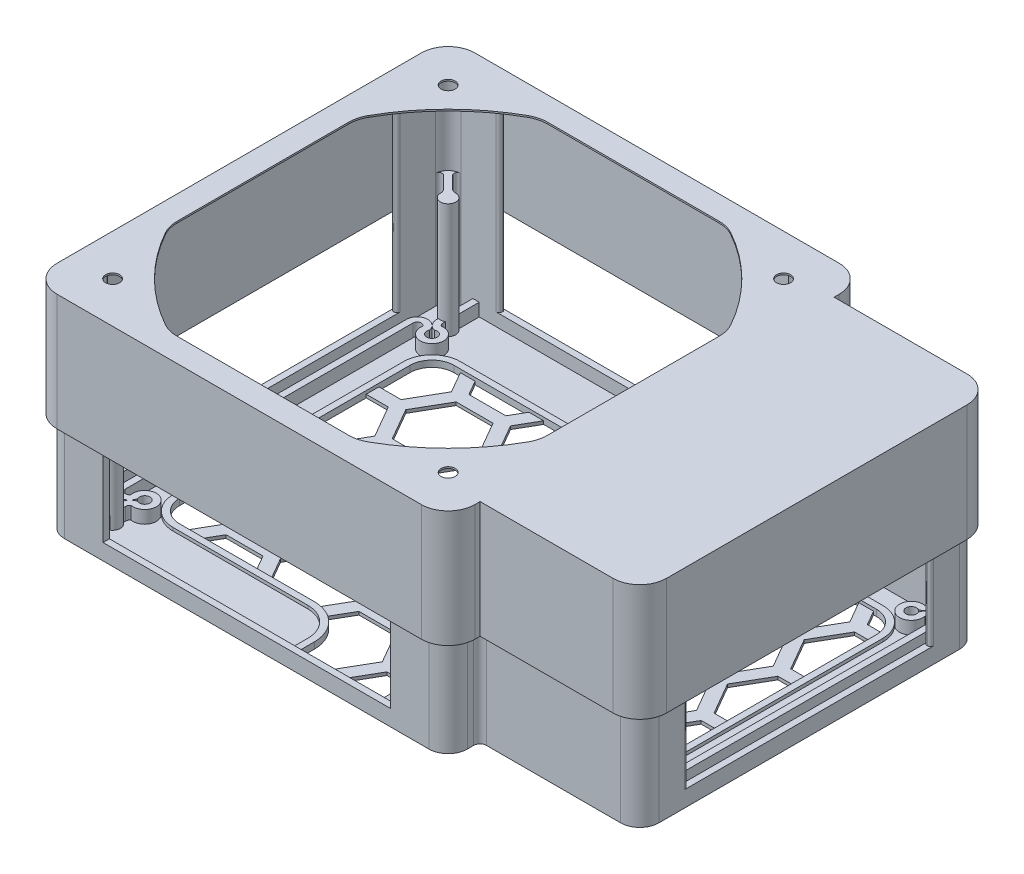
from build123d import *
from build123d.topology import SkipClean

# Parameters (mm, degrees)
BOSS_EXTRUDE1_DEPTH = 1
EXTRUDE_THIN1_START = 66
EXTRUDE_THIN1_DEPTH = 66
EXTRUDE_THIN3_DEPTH = 4
EXTRUDE_THIN4_DEPTH = 4
EXTRUDE_THIN5_DEPTH = 1
EXTRUDE_THIN6_DEPTH = 1
CUT_EXTRUDE1_START  = -1
CUT_EXTRUDE1_DEPTH  = 1
EXTRUDE_THIN7_DEPTH = 36
SKETCH9_R           = 2.2
BOSS_EXTRUDE2_DEPTH = 0.5
SKETCH10_W          = 7.592650154
SKETCH10_H          = 90
SKETCH10_W_2        = 89.999982454
SKETCH10_H_2        = 7.943548526
SKETCH10_W_3        = 13.63014597
SKETCH10_H_3        = 76
CUT_EXTRUDE2_DEPTH  = 62
FILLET1_R           = 1
BOSS_EXTRUDE3_DEPTH = 36
FILLET2_R           = 1


with BuildPart() as part:
    # Sketch1 → Boss-Extrude1 (new body)
    with BuildSketch(Plane(origin=(0, 0, 0), x_dir=(1, 0, 0), z_dir=(0, 1, 0))):
        with BuildLine():
            Line((40.005285897, 52.999974942), (81.994696809, 52.999974942))
            ThreePointArc((81.994696809, 52.999974942), (86.237336778, 51.242616347), (87.994696809, 46.999976973))
            Line((87.994696809, 46.999976973), (87.994728634, -46.999975311))
            ThreePointArc((87.994728634, -46.999975311), (86.237370039, -51.242617311), (81.994728634, -52.999977342))
            Line((81.994728634, -52.999977342), (40.005285897, -52.999977342))
            ThreePointArc((40.005285897, -52.999977342), (38.591072335, -53.58576378), (38.005285897, -54.999977342))
            Line((38.005285897, -54.999977342), (38.005285897, -57))
            ThreePointArc((38.005285897, -57), (36.247926584, -61.242640687), (32.005285897, -63))
            Line((32.005285897, -63), (-81.994731649, -63))
            ThreePointArc((-81.994731649, -63), (-86.237372989, -61.242640034), (-87.994731649, -56.999998153))
            Line((-87.994731649, -56.999998153), (-87.994696557, 57.000001847))
            ThreePointArc((-87.994696557, 57.000001847), (-86.237336591, 61.24264134), (-81.994696557, 63))
            Line((-81.994696557, 63), (32.005285897, 63))
            ThreePointArc((32.005285897, 63), (36.247926584, 61.242640687), (38.005285897, 57))
            Line((38.005285897, 57), (38.005285897, 54.999974942))
            ThreePointArc((38.005285897, 54.999974942), (38.591072335, 53.58576138), (40.005285897, 52.999974942))
        make_face()
    extrude(amount=-BOSS_EXTRUDE1_DEPTH)

    # Sketch2 → Extrude-Thin1 (add)
    with BuildSketch(Plane(origin=(0, 0, 0), x_dir=(1, 0, 0), z_dir=(0, 1, 0)).offset(EXTRUDE_THIN1_START)):
        with BuildLine():
            Line((38.005285897, 54.999974942), (38.005285897, 57))
            ThreePointArc((38.005285897, 57), (36.247926584, 61.242640687), (32.005285897, 63))
            Line((32.005285897, 63), (-81.994696557, 63))
            ThreePointArc((-81.994696557, 63), (-86.237336591, 61.24264134), (-87.994696557, 57.000001847))
            Line((-87.994696557, 57.000001847), (-87.994731649, -56.999998153))
            ThreePointArc((-87.994731649, -56.999998153), (-86.237372989, -61.242640034), (-81.994731649, -63))
            Line((-81.994731649, -63), (32.005285897, -63))
            ThreePointArc((32.005285897, -63), (36.247926584, -61.242640687), (38.005285897, -57))
            Line((38.005285897, -57), (38.005285897, -54.999977342))
            ThreePointArc((38.005285897, -54.999977342), (38.591072335, -53.58576378), (40.005285897, -52.999977342))
            Line((40.005285897, -52.999977342), (81.994728634, -52.999977342))
            ThreePointArc((81.994728634, -52.999977342), (86.237370039, -51.242617311), (87.994728634, -46.999975311))
            Line((87.994728634, -46.999975311), (87.994696809, 46.999976973))
            ThreePointArc((87.994696809, 46.999976973), (86.237336778, 51.242616347), (81.994696809, 52.999974942))
            Line((81.994696809, 52.999974942), (40.005285897, 52.999974942))
            ThreePointArc((40.005285897, 52.999974942), (38.591072335, 53.58576138), (38.005285897, 54.999974942))
        make_face()
        with BuildLine():
            Line((36.005285897, 54.999974942), (36.005285897, 57))
            ThreePointArc((36.005285897, 57), (34.833713022, 59.828427125), (32.005285897, 61))
            Line((32.005285897, 61), (-81.994696557, 61))
            ThreePointArc((-81.994696557, 61), (-84.823123246, 59.82842756), (-85.994696557, 57.000001231))
            Line((-85.994696557, 57.000001231), (-85.994731649, -56.999998769))
            ThreePointArc((-85.994731649, -56.999998769), (-84.823159209, -59.828426689), (-81.994731649, -61))
            Line((-81.994731649, -61), (32.005285897, -61))
            ThreePointArc((32.005285897, -61), (34.833713022, -59.828427125), (36.005285897, -57))
            Line((36.005285897, -57), (36.005285897, -54.999977342))
            ThreePointArc((36.005285897, -54.999977342), (37.176858772, -52.171550217), (40.005285897, -50.999977342))
            Line((40.005285897, -50.999977342), (81.994728634, -50.999977342))
            ThreePointArc((81.994728634, -50.999977342), (84.823156237, -49.828403988), (85.994728634, -46.999975988))
            Line((85.994728634, -46.999975988), (85.994696809, 46.999976296))
            ThreePointArc((85.994696809, 46.999976296), (84.823123455, 49.828402546), (81.994696809, 50.999974942))
            Line((81.994696809, 50.999974942), (40.005285897, 50.999974942))
            ThreePointArc((40.005285897, 50.999974942), (37.176858772, 52.171547817), (36.005285897, 54.999974942))
        make_face(mode=Mode.SUBTRACT)
    extrude(amount=-EXTRUDE_THIN1_DEPTH)

    # Sketch5 → Extrude-Thin3 (add)
    with BuildSketch(Plane(origin=(0, 0, 0), x_dir=(1, 0, 0), z_dir=(0, 1, 0))):
        with BuildLine():
            ThreePointArc((74.918497185, 50.999974942), (76.200703863, 50.05163324), (75.669349846, 48.547948147))
            ThreePointArc((75.669349846, 48.547948147), (72.440089862, 42.362287591), (78.586050254, 45.666479991))
            ThreePointArc((78.586050254, 45.666479991), (80.043916618, 46.249610745), (80.994697517, 45.000038221))
            Line((80.994697517, 45.000038221), (80.994727987, -45.00003632))
            ThreePointArc((80.994727987, -45.00003632), (80.043947973, -46.249609517), (78.586081196, -45.666479795))
            ThreePointArc((78.586081196, -45.666479795), (72.440118466, -42.362291746), (75.669382828, -48.547950015))
            ThreePointArc((75.669382828, -48.547950015), (76.20073791, -50.051634733), (74.918531902, -50.999977342))
            Line((74.918531902, -50.999977342), (74.918533165, -52.999977342))
            ThreePointArc((74.918533165, -52.999977342), (78.232434366, -50.083455911), (75.760562201, -46.425876598))
            ThreePointArc((75.760562201, -46.425876598), (73.834476737, -43.796279976), (76.477656958, -45.703681856))
            ThreePointArc((76.477656958, -45.703681856), (80.052074613, -48.27751059), (82.994727987, -45.000034877))
            Line((82.994727987, -45.000034877), (82.994697517, 45.000038663))
            ThreePointArc((82.994697517, 45.000038663), (80.052041589, 48.277511849), (76.477625989, 45.70368056))
            ThreePointArc((76.477625989, 45.70368056), (73.834447119, 43.796276809), (75.760530721, 46.425874794))
            ThreePointArc((75.760530721, 46.425874794), (78.232400297, 50.083455857), (74.918497032, 52.999974942))
            Line((74.918497032, 52.999974942), (74.918497185, 50.999974942))
        make_face()
    extrude(amount=EXTRUDE_THIN3_DEPTH)

    # Sketch5<3> → Extrude-Thin4 (add)
    with BuildSketch(Plane(origin=(0, 0, 0), x_dir=(1, 0, 0), z_dir=(0, 1, 0))):
        with BuildLine():
            Line((-76.259475574, 61), (-76.259475574, 49.658997291))
            ThreePointArc((-76.259475574, 49.658997291), (-76.102791071, 49.029974176), (-75.669352751, 48.547945821))
            ThreePointArc((-75.669352751, 48.547945821), (-72.440092577, 42.362285365), (-78.58605307, 45.666477576))
            ThreePointArc((-78.58605307, 45.666477576), (-80.043919452, 46.249608285), (-80.994700312, 45.000035731))
            Line((-80.994700312, 45.000035731), (-80.994728016, -45.000038809))
            ThreePointArc((-80.994728016, -45.000038809), (-80.043947964, -46.249611978), (-78.586081205, -45.666482211))
            ThreePointArc((-78.586081205, -45.666482211), (-72.440118576, -42.362293973), (-75.669382749, -48.547952341))
            ThreePointArc((-75.669382749, -48.547952341), (-76.102821583, -49.029980799), (-76.25950629, -49.659004297))
            Line((-76.25950629, -49.659004297), (-76.25950629, -61))
            Line((-76.25950629, -61), (-78.25950629, -61))
            Line((-78.25950629, -61), (-78.25950629, -49.659004297))
            ThreePointArc((-78.25950629, -49.659004297), (-77.561949364, -47.615855912), (-75.760562187, -46.425878927))
            ThreePointArc((-75.760562187, -46.425878927), (-73.834476804, -43.796282246), (-76.477656965, -45.703684207))
            ThreePointArc((-76.477656965, -45.703684207), (-80.052073943, -48.277513115), (-82.994728016, -45.000038633))
            Line((-82.994728016, -45.000038633), (-82.994700312, 45.000036746))
            ThreePointArc((-82.994700312, 45.000036746), (-80.052044171, 48.277509422), (-76.477628806, 45.703678209))
            ThreePointArc((-76.477628806, 45.703678209), (-73.834449877, 43.796274539), (-75.760533561, 46.425872465))
            ThreePointArc((-75.760533561, 46.425872465), (-77.561919308, 47.615849761), (-78.259475574, 49.658997291))
            Line((-78.259475574, 49.658997291), (-78.259475574, 61))
            Line((-78.259475574, 61), (-76.259475574, 61))
        make_face()
    extrude(amount=EXTRUDE_THIN4_DEPTH)

    # Sketch6 → Extrude-Thin5 (add)
    with BuildSketch(Plane(origin=(0, 0, 0), x_dir=(1, 0, 0), z_dir=(0, 1, 0))):
        with BuildLine():
            Line((-14.999999769, -61), (-14.999999878, -53.858864547))
            ThreePointArc((-14.999999878, -53.858864547), (-17.606749574, -47.565614282), (-23.899999878, -44.958864683))
            Line((-23.899999878, -44.958864683), (-66.105302112, -44.958864683))
            ThreePointArc((-66.105302112, -44.958864683), (-72.398552465, -42.352115036), (-75.005302112, -36.058864683))
            Line((-75.005302112, -36.058864683), (-75.005302112, 36.058860039))
            ThreePointArc((-75.005302112, 36.058860039), (-72.398552465, 42.352110392), (-66.105302112, 44.958860039))
            Line((-66.105302112, 44.958860039), (-23.900001534, 44.958860039))
            ThreePointArc((-23.900001534, 44.958860039), (-17.606751133, 47.565609735), (-15.000001534, 53.858860176))
            Line((-15.000001534, 53.858860176), (-15.000001644, 61))
            Line((-15.000001644, 61), (-13.000001644, 61.000000031))
            Line((-13.000001644, 61.000000031), (-13.000001534, 53.858860207))
            ThreePointArc((-13.000001534, 53.858860207), (-16.19253756, 46.151396183), (-23.900001534, 42.958860039))
            Line((-23.900001534, 42.958860039), (-66.105302112, 42.958860039))
            ThreePointArc((-66.105302112, 42.958860039), (-70.984338902, 40.937896829), (-73.005302112, 36.058860039))
            Line((-73.005302112, 36.058860039), (-73.005302112, -36.058864683))
            ThreePointArc((-73.005302112, -36.058864683), (-70.984338902, -40.937901474), (-66.105302112, -42.958864683))
            Line((-66.105302112, -42.958864683), (-23.899999878, -42.958864683))
            ThreePointArc((-23.899999878, -42.958864683), (-16.192536023, -46.151400709), (-12.999999878, -53.858864516))
            Line((-12.999999878, -53.858864516), (-12.999999769, -60.999999969))
            Line((-12.999999769, -60.999999969), (-14.999999769, -61))
        make_face()
    extrude(amount=EXTRUDE_THIN5_DEPTH)

    # Sketch6<3> → Extrude-Thin6 (add)
    with BuildSketch(Plane(origin=(0, 0, 0), x_dir=(1, 0, 0), z_dir=(0, 1, 0))):
        with BuildLine():
            Line((14.999998356, 61), (14.999998466, 53.858859902))
            ThreePointArc((14.999998466, 53.858859902), (17.606748162, 47.565609638), (23.899998466, 44.958860039))
            Line((23.899998466, 44.958860039), (66.105329759, 44.958860039))
            ThreePointArc((66.105329759, 44.958860039), (72.398580112, 42.352110392), (75.005329759, 36.058860039))
            Line((75.005329759, 36.058860039), (75.005329759, -36.058864683))
            ThreePointArc((75.005329759, -36.058864683), (72.398580112, -42.352115036), (66.105329759, -44.958864683))
            Line((66.105329759, -44.958864683), (23.900000122, -44.958864683))
            ThreePointArc((23.900000122, -44.958864683), (17.606749721, -47.565614379), (15.000000122, -53.85886482))
            Line((15.000000122, -53.85886482), (15.000000231, -61))
            Line((15.000000231, -61), (13.000000231, -61.000000031))
            Line((13.000000231, -61.000000031), (13.000000122, -53.858864851))
            ThreePointArc((13.000000122, -53.858864851), (16.192536147, -46.151400828), (23.900000122, -42.958864683))
            Line((23.900000122, -42.958864683), (66.105329759, -42.958864683))
            ThreePointArc((66.105329759, -42.958864683), (70.98436655, -40.937901474), (73.005329759, -36.058864683))
            Line((73.005329759, -36.058864683), (73.005329759, 36.058860039))
            ThreePointArc((73.005329759, 36.058860039), (70.98436655, 40.937896829), (66.105329759, 42.958860039))
            Line((66.105329759, 42.958860039), (23.899998466, 42.958860039))
            ThreePointArc((23.899998466, 42.958860039), (16.19253461, 46.151396065), (12.999998466, 53.858859872))
            Line((12.999998466, 53.858859872), (12.999998356, 60.999999969))
            Line((12.999998356, 60.999999969), (14.999998356, 61))
        make_face()
    extrude(amount=EXTRUDE_THIN6_DEPTH)

    # Sketch7 → Cut-Extrude1 (cut)
    with SkipClean():  # the faces are left unmerged after this step: merging them gives an invalid solid
        with BuildSketch(Plane(origin=(0, 0, 0), x_dir=(1, 0, 0), z_dir=(0, 1, 0)).offset(CUT_EXTRUDE1_START)):
            with BuildLine():
                ThreePointArc((12.999998466, 53.858859872), (13.144002622, 52.092917398), (13.572210047, 50.373636032))
                Line((13.572210047, 50.373636032), (5.499608082, 50.373636032))
                Line((5.499608082, 50.373636032), (0.519174523, 59))
                Line((0.519174523, 59), (12.999998466, 59))
                Line((12.999998466, 59), (12.999998466, 53.858859872))
            make_face()
            with BuildLine():
                ThreePointArc((-18.695871981, 44.281436816), (-14.531570136, 48.287280987), (-13.000001534, 53.858860207))
                Line((-13.000001534, 53.858860207), (-13.000001534, 58.373636032))
                Line((-13.000001534, 58.373636032), (-3.737996225, 58.373636032))
                Line((-3.737996225, 58.373636032), (2.035506467, 48.373636032))
                Line((2.035506467, 48.373636032), (-3.737996225, 38.373636032))
                Line((-3.737996225, 38.373636032), (-15.285001609, 38.373636032))
                Line((-15.285001609, 38.373636032), (-18.695871981, 44.281436816))
            make_face()
            with BuildLine():
                ThreePointArc((15.976525644, 46.373636032), (16.949413744, 45.462469622), (18.026243858, 44.676866421))
                Line((18.026243858, 44.676866421), (22.820116158, 36.373636032))
                Line((22.820116158, 36.373636032), (17.046613466, 26.373636032))
                Line((17.046613466, 26.373636032), (5.499608082, 26.373636032))
                Line((5.499608082, 26.373636032), (-0.27389461, 36.373636032))
                Line((-0.27389461, 36.373636032), (5.499608082, 46.373636032))
                Line((5.499608082, 46.373636032), (15.976525644, 46.373636032))
            make_face()
            with BuildLine():
                ThreePointArc((23.635078471, 42.9620799), (23.767528685, 42.959665034), (23.899998466, 42.958860039))
                Line((23.899998466, 42.958860039), (40.478503472, 42.958860039))
                Line((40.478503472, 42.958860039), (37.831223157, 38.373636032))
                Line((37.831223157, 38.373636032), (26.284217773, 38.373636032))
                Line((26.284217773, 38.373636032), (23.635078471, 42.9620799))
            make_face()
            Polygon((58.615832848, 26.373636032), (64.389335539, 36.373636032), (60.587354686, 42.958860039), (45.097305625, 42.958860039), (41.295324772, 36.373636032), (47.068827464, 26.373636032), align=None)
            with BuildLine():
                Line((67.853437155, 38.373636032), (72.60546915, 38.373636032))
                ThreePointArc((72.60546915, 38.373636032), (70.082643278, 41.697208838), (66.105329759, 42.958860039))
                Line((66.105329759, 42.958860039), (65.20615684, 42.958860039))
                Line((65.20615684, 42.958860039), (67.853437155, 38.373636032))
            make_face()
            Polygon((62.079934463, 24.373636032), (67.853437155, 14.373636032), (73.005329759, 14.373636032), (73.005329759, 34.373636032), (67.853437155, 34.373636032), align=None)
            Polygon((58.615832848, 2.373636032), (64.389335539, 12.373636032), (58.615832848, 22.373636032), (47.068827464, 22.373636032), (41.295324772, 12.373636032), (47.068827464, 2.373636032), align=None)
            Polygon((37.831223157, 14.373636032), (43.604725849, 24.373636032), (37.831223157, 34.373636032), (26.284217773, 34.373636032), (20.510715081, 24.373636032), (26.284217773, 14.373636032), align=None)
            Polygon((62.079934463, 0.373636032), (67.853437155, -9.626363968), (73.005329759, -9.626363968), (73.005329759, 10.373636032), (67.853437155, 10.373636032), align=None)
            Polygon((62.079934463, -23.626363968), (67.853437155, -33.626363968), (73.005329759, -33.626363968), (73.005329759, -13.626363968), (67.853437155, -13.626363968), align=None)
            Polygon((60.155914278, -42.958864683), (64.389335539, -35.626363968), (58.615832848, -25.626363968), (47.068827464, -25.626363968), (41.295324772, -35.626363968), (45.528746034, -42.958864683), align=None)
            Polygon((58.615832848, -21.626363968), (64.389335539, -11.626363968), (58.615832848, -1.626363968), (47.068827464, -1.626363968), (41.295324772, -11.626363968), (47.068827464, -21.626363968), align=None)
            with BuildLine():
                Line((64.774716431, -42.958864683), (66.105329759, -42.958864683))
                ThreePointArc((66.105329759, -42.958864683), (70.394517033, -41.463758071), (72.824923943, -37.626363968))
                Line((72.824923943, -37.626363968), (67.853437155, -37.626363968))
                Line((67.853437155, -37.626363968), (64.774716431, -42.958864683))
            make_face()
            with BuildLine():
                ThreePointArc((23.900000121, -42.958864683), (23.545921025, -42.964617211), (23.192215662, -42.981868721))
                Line((23.192215662, -42.981868721), (26.284217773, -37.626363968))
                Line((26.284217773, -37.626363968), (37.831223157, -37.626363968))
                Line((37.831223157, -37.626363968), (40.90994388, -42.958864683))
                Line((40.90994388, -42.958864683), (23.900000121, -42.958864683))
            make_face()
            Polygon((37.831223157, -33.626363968), (43.604725849, -23.626363968), (37.831223157, -13.626363968), (26.284217773, -13.626363968), (20.510715081, -23.626363968), (26.284217773, -33.626363968), align=None)
            Polygon((37.831223157, -9.626363968), (43.604725849, 0.373636032), (37.831223157, 10.373636032), (26.284217773, 10.373636032), (20.510715081, 0.373636032), (26.284217773, -9.626363968), align=None)
            Polygon((17.046613466, 2.373636032), (22.820116158, 12.373636032), (17.046613466, 22.373636032), (5.499608082, 22.373636032), (-0.27389461, 12.373636032), (5.499608082, 2.373636032), align=None)
            Polygon((17.046613466, -21.626363968), (22.820116158, -11.626363968), (17.046613466, -1.626363968), (5.499608082, -1.626363968), (-0.27389461, -11.626363968), (5.499608082, -21.626363968), align=None)
            Polygon((-3.737996225, -9.626363968), (2.035506467, 0.373636032), (-3.737996225, 10.373636032), (-15.285001609, 10.373636032), (-21.058504301, 0.373636032), (-15.285001609, -9.626363968), align=None)
            Polygon((-3.737996225, 14.373636032), (2.035506467, 24.373636032), (-3.737996225, 34.373636032), (-15.285001609, 34.373636032), (-21.058504301, 24.373636032), (-15.285001609, 14.373636032), align=None)
            with BuildLine():
                ThreePointArc((-23.900001534, 42.958860039), (-23.246958673, 42.978440239), (-22.596261998, 43.037110494))
                Line((-22.596261998, 43.037110494), (-18.749103224, 36.373636032))
                Line((-18.749103224, 36.373636032), (-24.522605916, 26.373636032))
                Line((-24.522605916, 26.373636032), (-36.0696113, 26.373636032))
                Line((-36.0696113, 26.373636032), (-41.843113991, 36.373636032))
                Line((-41.843113991, 36.373636032), (-38.041133138, 42.958860039))
                Line((-38.041133138, 42.958860039), (-23.900001534, 42.958860039))
            make_face()
            Polygon((-56.85422099, 38.373636032), (-45.307215607, 38.373636032), (-42.659935292, 42.958860039), (-59.501501305, 42.958860039), align=None)
            with BuildLine():
                Line((-66.105302112, 42.958860039), (-64.120303459, 42.958860039))
                Line((-64.120303459, 42.958860039), (-60.318322605, 36.373636032))
                Line((-60.318322605, 36.373636032), (-66.091825297, 26.373636032))
                Line((-66.091825297, 26.373636032), (-73.005302112, 26.373636032))
                Line((-73.005302112, 26.373636032), (-73.005302112, 36.058860039))
                ThreePointArc((-73.005302112, 36.058860039), (-70.984338902, 40.937896829), (-66.105302112, 42.958860039))
            make_face()
            Polygon((-45.307215607, 14.373636032), (-39.533712915, 24.373636032), (-45.307215607, 34.373636032), (-56.85422099, 34.373636032), (-62.627723682, 24.373636032), (-56.85422099, 14.373636032), align=None)
            Polygon((-24.522605916, 2.373636032), (-18.749103224, 12.373636032), (-24.522605916, 22.373636032), (-36.0696113, 22.373636032), (-41.843113991, 12.373636032), (-36.0696113, 2.373636032), align=None)
            with BuildLine():
                Line((22.820116158, -35.626363968), (17.046613466, -25.626363968))
                Line((17.046613466, -25.626363968), (5.499608082, -25.626363968))
                Line((5.499608082, -25.626363968), (-0.27389461, -35.626363968))
                Line((-0.27389461, -35.626363968), (5.499608082, -45.626363968))
                Line((5.499608082, -45.626363968), (16.756056395, -45.626363968))
                ThreePointArc((16.756056395, -45.626363968), (17.026126792, -45.399558243), (17.303393253, -45.18160833))
                Line((17.303393253, -45.18160833), (22.820116158, -35.626363968))
            make_face()
            Polygon((-3.737996225, -33.626363968), (2.035506467, -23.626363968), (-3.737996225, -13.626363968), (-15.285001609, -13.626363968), (-21.058504301, -23.626363968), (-15.285001609, -33.626363968), align=None)
            Polygon((-24.522605916, -21.626363968), (-18.749103224, -11.626363968), (-24.522605916, -1.626363968), (-36.0696113, -1.626363968), (-41.843113991, -11.626363968), (-36.0696113, -21.626363968), align=None)
            Polygon((-45.307215607, -9.626363968), (-39.533712915, 0.373636032), (-45.307215607, 10.373636032), (-56.85422099, 10.373636032), (-62.627723682, 0.373636032), (-56.85422099, -9.626363968), align=None)
            Polygon((-66.091825297, 2.373636032), (-60.318322605, 12.373636032), (-66.091825297, 22.373636032), (-73.005302112, 22.373636032), (-73.005302112, 2.373636032), align=None)
            Polygon((-66.091825297, -21.626363968), (-60.318322605, -11.626363968), (-66.091825297, -1.626363968), (-73.005302112, -1.626363968), (-73.005302112, -21.626363968), align=None)
            Polygon((-45.307215607, -33.626363968), (-39.533712915, -23.626363968), (-45.307215607, -13.626363968), (-56.85422099, -13.626363968), (-62.627723682, -23.626363968), (-56.85422099, -33.626363968), align=None)
            with BuildLine():
                ThreePointArc((-23.003830343, -42.995767511), (-23.451535372, -42.968094298), (-23.899999878, -42.958864683))
                Line((-23.899999878, -42.958864683), (-37.60969273, -42.958864683))
                Line((-37.60969273, -42.958864683), (-41.843113991, -35.626363968))
                Line((-41.843113991, -35.626363968), (-36.0696113, -25.626363968))
                Line((-36.0696113, -25.626363968), (-24.522605916, -25.626363968))
                Line((-24.522605916, -25.626363968), (-18.749103224, -35.626363968))
                Line((-18.749103224, -35.626363968), (-23.003830343, -42.995767511))
            make_face()
            with BuildLine():
                ThreePointArc((-12.999999878, -53.858864516), (-14.628529403, -48.127387105), (-19.027492431, -44.108548218))
                Line((-19.027492431, -44.108548218), (-15.285001609, -37.626363968))
                Line((-15.285001609, -37.626363968), (-3.737996225, -37.626363968))
                Line((-3.737996225, -37.626363968), (2.035506467, -47.626363968))
                Line((2.035506467, -47.626363968), (-3.737996225, -57.626363968))
                Line((-3.737996225, -57.626363968), (-12.999999878, -57.626363968))
                Line((-12.999999878, -57.626363968), (-12.999999878, -53.858864516))
            make_face()
            with BuildLine():
                ThreePointArc((13.855303128, -49.626363968), (13.215965351, -51.699836886), (13.000000121, -53.858864851))
                Line((13.000000121, -53.858864851), (13.000000121, -59))
                Line((13.000000121, -59), (0.087736796, -59))
                Line((0.087736796, -59), (5.499608082, -49.626363968))
                Line((5.499608082, -49.626363968), (13.855303128, -49.626363968))
            make_face()
            Polygon((-59.932941714, -42.958864683), (-42.228494883, -42.958864683), (-45.307215607, -37.626363968), (-56.85422099, -37.626363968), align=None)
            with BuildLine():
                Line((-73.005302112, -25.626363968), (-73.005302112, -36.058864683))
                ThreePointArc((-73.005302112, -36.058864683), (-70.984338902, -40.937901474), (-66.105302112, -42.958864683))
                Line((-66.105302112, -42.958864683), (-64.551743867, -42.958864683))
                Line((-64.551743867, -42.958864683), (-60.318322605, -35.626363968))
                Line((-60.318322605, -35.626363968), (-66.091825297, -25.626363968))
                Line((-66.091825297, -25.626363968), (-73.005302112, -25.626363968))
            make_face()
        extrude(amount=CUT_EXTRUDE1_DEPTH, mode=Mode.SUBTRACT)

    # Sketch10 → Cut-Extrude2 (cut)
    with SkipClean():  # the faces are left unmerged after this step: merging them gives an invalid solid
        with BuildSketch(Plane(origin=(0, 66, 0), x_dir=(1, 0, 0), z_dir=(0, 1, 0))):
            with Locations((-87.994714103, 1.847e-06)):
                Rectangle(SKETCH10_W, SKETCH10_H)
            with Locations((-24.99470533, 61)):
                Rectangle(SKETCH10_W_2, SKETCH10_H_2)
            with Locations((87.994712721, 8.31e-07)):
                Rectangle(SKETCH10_W_3, SKETCH10_H_3)
            with Locations((-24.99470533, -61)):
                Rectangle(SKETCH10_W_2, SKETCH10_H_2)
        extrude(amount=-CUT_EXTRUDE2_DEPTH, mode=Mode.SUBTRACT)

    # Fillet1
    fillet1_edges = [part.edges().sort_by_distance(p)[0] for p in [
        (-87.994727955, 35, 44.999998153),
        (-85.994727955, 35, 44.999998153),
        (85.994725587, 35, 37.999999169),
        (87.994725587, 35, 37.999999169),
        (87.994699856, 35, -38.000000831),
        (85.994699856, 35, -38.000000831),
        (20.005285897, 35, -63),
        (20.005285897, 35, -61),
        (-69.994696557, 35, -63),
        (-69.994696557, 35, -61),
        (-85.994700251, 35, -45.000001847),
        (-87.994700251, 35, -45.000001847),
    ]]
    fillet(fillet1_edges, radius=FILLET1_R - 0.0001)  # a hair under: the kernel refuses the full size

    # Sketch12 → Boss-Extrude3 (add)
    with BuildSketch(Plane(origin=(0, 0, 0), x_dir=(1, 0, 0), z_dir=(0, 1, 0))):
        with BuildLine():
            Line((-85.530230916, 59.121321667), (-80.538483126, 54.129561332))
            ThreePointArc((-80.538483126, 54.129561332), (-80.054884641, 53.399470102), (-79.894404136, 52.538571323))
            ThreePointArc((-79.894404136, 52.538571323), (-75.79765996, 50.802941593), (-77.533279395, 54.89969013))
            ThreePointArc((-77.533279395, 54.89969013), (-78.394177771, 55.060172798), (-79.124267786, 55.543773118))
            Line((-79.124267786, 55.543773118), (-84.116015577, 60.535533453))
            ThreePointArc((-84.116015577, 60.535533453), (-85.530229139, 60.53553523), (-85.530230916, 59.121321667))
        make_face()
        with BuildLine():
            Line((34.126604917, 60.535533453), (29.134857126, 55.543773118))
            ThreePointArc((29.134857126, 55.543773118), (28.404767111, 55.060172798), (27.543868735, 54.89969013))
            ThreePointArc((27.543868735, 54.89969013), (25.808249301, 50.802941593), (29.904993476, 52.538571323))
            ThreePointArc((29.904993476, 52.538571323), (30.065473981, 53.399470102), (30.549072466, 54.129561332))
            Line((30.549072466, 54.129561332), (35.540820256, 59.121321667))
            ThreePointArc((35.540820256, 59.121321667), (35.540818479, 60.53553523), (34.126604917, 60.535533453))
        make_face()
        with BuildLine():
            Line((35.540820256, -59.121321667), (30.549072466, -54.129561332))
            ThreePointArc((30.549072466, -54.129561332), (30.065473981, -53.399470102), (29.904993476, -52.538571323))
            ThreePointArc((29.904993476, -52.538571323), (25.808249301, -50.802941593), (27.543868735, -54.89969013))
            ThreePointArc((27.543868735, -54.89969013), (28.404767111, -55.060172798), (29.134857126, -55.543773118))
            Line((29.134857126, -55.543773118), (34.126604917, -60.535533453))
            ThreePointArc((34.126604917, -60.535533453), (35.540818479, -60.53553523), (35.540820256, -59.121321667))
        make_face()
        with BuildLine():
            Line((-84.116015577, -60.535533453), (-79.124267786, -55.543773118))
            ThreePointArc((-79.124267786, -55.543773118), (-78.394177771, -55.060172798), (-77.533279395, -54.89969013))
            ThreePointArc((-77.533279395, -54.89969013), (-75.79765996, -50.802941593), (-79.894404136, -52.538571323))
            ThreePointArc((-79.894404136, -52.538571323), (-80.054884641, -53.399470102), (-80.538483126, -54.129561332))
            Line((-80.538483126, -54.129561332), (-85.530230916, -59.121321667))
            ThreePointArc((-85.530230916, -59.121321667), (-85.530229139, -60.53553523), (-84.116015577, -60.535533453))
        make_face()
    extrude(amount=BOSS_EXTRUDE3_DEPTH)

    # Fillet2
    fillet2_edges = [part.edges().sort_by_distance(p)[0] for p in [
        (-84.026202158, 18, -60.445719808),
        (-85.440415886, 18, -59.031506412),
        (35.451005227, 18, -59.031506412),
        (34.036791498, 18, -60.445719808),
        (34.036791498, 18, 60.445719808),
        (35.451005227, 18, 59.031506412),
        (-85.440437963, 18, 59.031528488),
        (-84.026215173, 18, 60.445732824),
    ]]
    fillet(fillet2_edges, radius=FILLET2_R)


with BuildPart() as body_2:
    # Sketch8 → Extrude-Thin7 (new body)
    with BuildSketch(Plane(origin=(0, 66, 0), x_dir=(1, 0, 0), z_dir=(0, 1, 0))):
        with BuildLine():
            Line((-90.394696557, 57.000002586), (-90.394731649, -56.999997414))
            ThreePointArc((-90.394731649, -56.999997414), (-87.934429525, -62.939696048), (-81.994731649, -65.4))
            Line((-81.994731649, -65.4), (32.005285897, -65.4))
            ThreePointArc((32.005285897, -65.4), (37.944982859, -62.939696962), (40.405285897, -57))
            Line((40.405285897, -57), (40.405285897, -55.399977342))
            Line((40.405285897, -55.399977342), (81.994728634, -55.399977342))
            ThreePointArc((81.994728634, -55.399977342), (87.934426601, -52.939673299), (90.394728634, -46.999974498))
            Line((90.394728634, -46.999974498), (90.394696809, 46.999977786))
            ThreePointArc((90.394696809, 46.999977786), (87.934392765, 52.939672909), (81.994696809, 55.399974942))
            Line((81.994696809, 55.399974942), (40.405285897, 55.399974942))
            Line((40.405285897, 55.399974942), (40.405285897, 57))
            ThreePointArc((40.405285897, 57), (37.944982859, 62.939696962), (32.005285897, 65.4))
            Line((32.005285897, 65.4), (-81.994696557, 65.4))
            ThreePointArc((-81.994696557, 65.4), (-87.934392605, 62.939697876), (-90.394696557, 57.000002586))
        make_face()
        with BuildLine():
            Line((-88.394696557, 57.00000197), (-88.394731649, -56.99999803))
            ThreePointArc((-88.394731649, -56.99999803), (-86.520215745, -61.525482703), (-81.994731649, -63.4))
            Line((-81.994731649, -63.4), (32.005285897, -63.4))
            ThreePointArc((32.005285897, -63.4), (36.530769297, -61.5254834), (38.405285897, -57))
            Line((38.405285897, -57), (38.405285897, -54.999977342))
            ThreePointArc((38.405285897, -54.999977342), (38.873915047, -53.868606492), (40.005285897, -53.399977342))
            Line((40.005285897, -53.399977342), (81.994728634, -53.399977342))
            ThreePointArc((81.994728634, -53.399977342), (86.520212799, -51.525459976), (88.394728634, -46.999975175))
            Line((88.394728634, -46.999975175), (88.394696809, 46.999977109))
            ThreePointArc((88.394696809, 46.999977109), (86.520179442, 51.525459108), (81.994696809, 53.399974942))
            Line((81.994696809, 53.399974942), (40.005285897, 53.399974942))
            ThreePointArc((40.005285897, 53.399974942), (38.873915047, 53.868604092), (38.405285897, 54.999974942))
            Line((38.405285897, 54.999974942), (38.405285897, 57))
            ThreePointArc((38.405285897, 57), (36.530769297, 61.5254834), (32.005285897, 63.4))
            Line((32.005285897, 63.4), (-81.994696557, 63.4))
            ThreePointArc((-81.994696557, 63.4), (-86.52017926, 61.525484096), (-88.394696557, 57.00000197))
        make_face(mode=Mode.SUBTRACT)
    extrude(amount=-EXTRUDE_THIN7_DEPTH)

    # Sketch9 → Boss-Extrude2 (add)
    # profile 1 of 2: a face of its own
    with BuildSketch(Plane(origin=(0, 66, 0), x_dir=(1, 0, 0), z_dir=(0, 1, 0))):
        with BuildLine():
            Line((40.405285897, 55.399974942), (40.405285897, 57))
            ThreePointArc((40.405285897, 57), (37.944982859, 62.939696962), (32.005285897, 65.4))
            Line((32.005285897, 65.4), (-81.994696557, 65.4))
            ThreePointArc((-81.994696557, 65.4), (-87.934392605, 62.939697876), (-90.394696557, 57.000002586))
            Line((-90.394696557, 57.000002586), (-90.394731649, -56.999997414))
            ThreePointArc((-90.394731649, -56.999997414), (-87.934429525, -62.939696048), (-81.994731649, -65.4))
            Line((-81.994731649, -65.4), (32.005285897, -65.4))
            ThreePointArc((32.005285897, -65.4), (37.944982859, -62.939696962), (40.405285897, -57))
            Line((40.405285897, -57), (40.405285897, -55.399977342))
            Line((40.405285897, -55.399977342), (81.994728634, -55.399977342))
            ThreePointArc((81.994728634, -55.399977342), (87.934426601, -52.939673299), (90.394728634, -46.999974498))
            Line((90.394728634, -46.999974498), (90.394696809, 46.999977786))
            ThreePointArc((90.394696809, 46.999977786), (87.934392765, 52.939672909), (81.994696809, 55.399974942))
            Line((81.994696809, 55.399974942), (40.405285897, 55.399974942))
        make_face()
        with BuildLine():
            Line((-81.994696557, 63.4), (32.005285897, 63.4))
            ThreePointArc((32.005285897, 63.4), (36.530769297, 61.5254834), (38.405285897, 57))
            Line((38.405285897, 57), (38.405285897, 54.999974942))
            ThreePointArc((38.405285897, 54.999974942), (38.873915047, 53.868604092), (40.005285897, 53.399974942))
            Line((40.005285897, 53.399974942), (81.994696809, 53.399974942))
            ThreePointArc((81.994696809, 53.399974942), (86.520179442, 51.525459108), (88.394696809, 46.999977109))
            Line((88.394696809, 46.999977109), (88.394728634, -46.999975175))
            ThreePointArc((88.394728634, -46.999975175), (86.520212799, -51.525459976), (81.994728634, -53.399977342))
            Line((81.994728634, -53.399977342), (40.005285897, -53.399977342))
            ThreePointArc((40.005285897, -53.399977342), (38.873915047, -53.868606492), (38.405285897, -54.999977342))
            Line((38.405285897, -54.999977342), (38.405285897, -57))
            ThreePointArc((38.405285897, -57), (36.530769297, -61.5254834), (32.005285897, -63.4))
            Line((32.005285897, -63.4), (-81.994731649, -63.4))
            ThreePointArc((-81.994731649, -63.4), (-86.520215745, -61.525482703), (-88.394731649, -56.99999803))
            Line((-88.394731649, -56.99999803), (-88.394696557, 57.00000197))
            ThreePointArc((-88.394696557, 57.00000197), (-86.52017926, 61.525484096), (-81.994696557, 63.4))
        make_face(mode=Mode.SUBTRACT)
    # profile 2 of 2: a face of its own
    with BuildSketch(Plane(origin=(0, 66, 0), x_dir=(1, 0, 0), z_dir=(0, 1, 0))):
        with BuildLine():
            ThreePointArc((32.005285897, 63.4), (36.530769297, 61.5254834), (38.405285897, 57))
            Line((38.405285897, 57), (38.405285897, 54.999974942))
            ThreePointArc((38.405285897, 54.999974942), (38.873915047, 53.868604092), (40.005285897, 53.399974942))
            Line((40.005285897, 53.399974942), (81.994696809, 53.399974942))
            ThreePointArc((81.994696809, 53.399974942), (86.520179442, 51.525459108), (88.394696809, 46.999977109))
            Line((88.394696809, 46.999977109), (88.394728634, -46.999975175))
            ThreePointArc((88.394728634, -46.999975175), (86.520212799, -51.525459976), (81.994728634, -53.399977342))
            Line((81.994728634, -53.399977342), (40.005285897, -53.399977342))
            ThreePointArc((40.005285897, -53.399977342), (38.873915047, -53.868606492), (38.405285897, -54.999977342))
            Line((38.405285897, -54.999977342), (38.405285897, -57))
            ThreePointArc((38.405285897, -57), (36.530769297, -61.5254834), (32.005285897, -63.4))
            Line((32.005285897, -63.4), (-81.994731649, -63.4))
            ThreePointArc((-81.994731649, -63.4), (-86.520215745, -61.525482703), (-88.394731649, -56.99999803))
            Line((-88.394731649, -56.99999803), (-88.394696557, 57.00000197))
            ThreePointArc((-88.394696557, 57.00000197), (-86.52017926, 61.525484096), (-81.994696557, 63.4))
            Line((-81.994696557, 63.4), (32.005285897, 63.4))
        make_face()
        with Locations(Location((-77.494714103, -52.5, 0), (0, 0, 270))):
            Circle(SKETCH9_R, mode=Mode.SUBTRACT)
        with Locations(Location((27.505285897, -52.5, 0), (0, 0, 270))):
            Circle(SKETCH9_R, mode=Mode.SUBTRACT)
        with Locations(Location((-77.494714103, 52.5, 0), (0, 0, 270))):
            Circle(SKETCH9_R, mode=Mode.SUBTRACT)
        with Locations(Location((27.505285897, 52.5, 0), (0, 0, 270))):
            Circle(SKETCH9_R, mode=Mode.SUBTRACT)
        with BuildLine():
            Line((-82.994718298, -26.851461014), (-82.994718298, 26.851461014))
            ThreePointArc((-82.994718298, 26.851461014), (-82.671306418, 29.3740871), (-81.721989825, 31.733543737))
            ThreePointArc((-81.721989825, 31.733543737), (-70.95665777, 45.961955389), (-56.728243373, 56.727283815))
            ThreePointArc((-56.728243373, 56.727283815), (-54.368787728, 57.676599484), (-51.846162876, 58.000011043))
            Line((-51.846162876, 58.000011043), (1.85673467, 58.000011043))
            ThreePointArc((1.85673467, 58.000011043), (4.379359522, 57.676599484), (6.738815167, 56.727283815))
            ThreePointArc((6.738815167, 56.727283815), (20.967204251, 45.961980703), (31.732526663, 31.733606223))
            ThreePointArc((31.732526663, 31.733606223), (32.681847245, 29.374145303), (33.005260515, 26.851513887))
            Line((33.005260515, 26.851513887), (33.005260515, -26.851513887))
            ThreePointArc((33.005260515, -26.851513887), (32.681847245, -29.374145303), (31.732526663, -31.733606223))
            ThreePointArc((31.732526663, -31.733606223), (20.9671853, -45.961999654), (6.738768388, -56.727309983))
            ThreePointArc((6.738768388, -56.727309983), (4.379315951, -57.676622666), (1.856695088, -58.000033185))
            Line((1.856695088, -58.000033185), (-51.846123294, -58.000033185))
            ThreePointArc((-51.846123294, -58.000033185), (-54.368744156, -57.676622666), (-56.728196594, -56.727309983))
            ThreePointArc((-56.728196594, -56.727309983), (-70.95663882, -45.96197434), (-81.721989825, -31.733543737))
            ThreePointArc((-81.721989825, -31.733543737), (-82.671306418, -29.3740871), (-82.994718298, -26.851461014))
        make_face(mode=Mode.SUBTRACT)
    extrude(amount=BOSS_EXTRUDE2_DEPTH)


solid = Compound([part.part, body_2.part])
